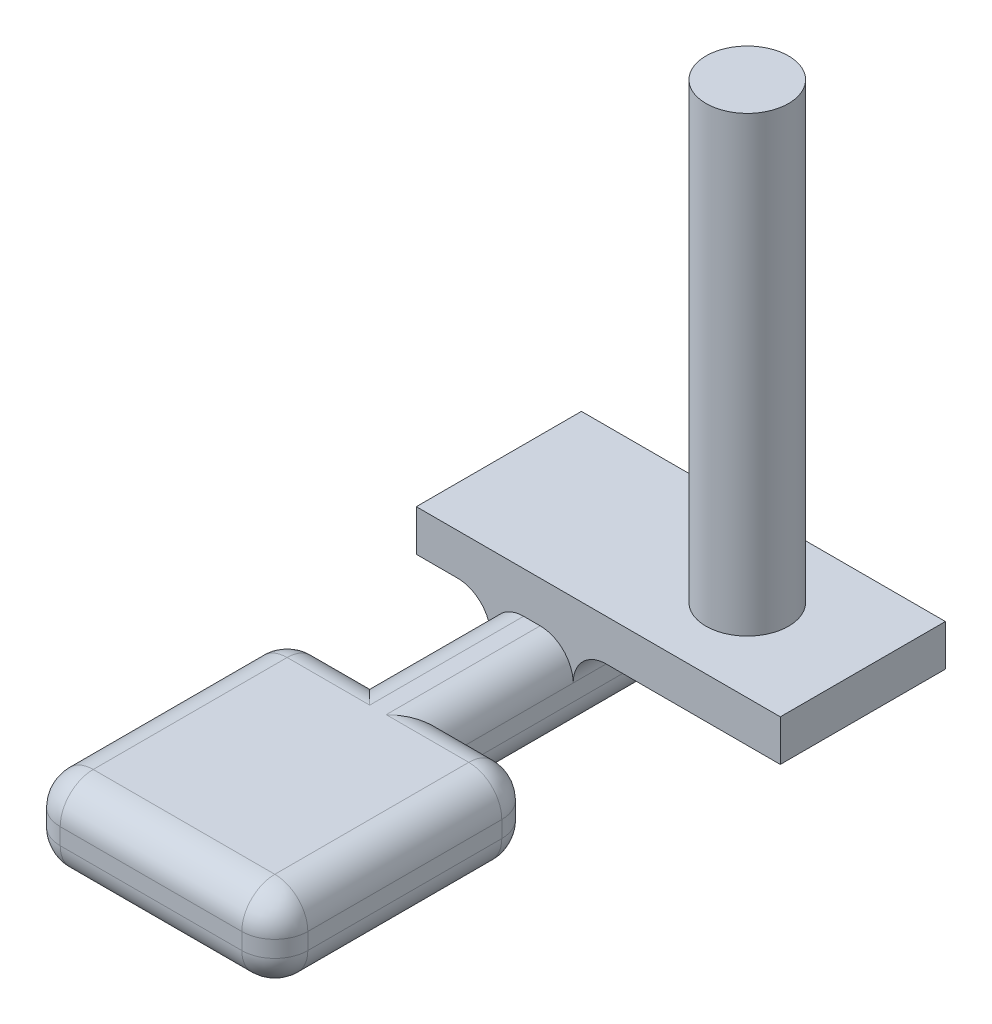
from build123d import *

# Parameters (mm, degrees)
SKETCH1_R           = 3.175
BOSS_EXTRUDE1_DEPTH = 19
SKETCH2_W           = 28
SKETCH2_H           = 12.7
BOSS_EXTRUDE2_DEPTH = 3.175
BOSS_EXTRUDE3_DEPTH = 6.35
FILLET1_R           = 2.54
FILLET2_R           = 2.54


with BuildPart() as part:
    # Sketch1 → Boss-Extrude1 (new, symmetric)
    with BuildSketch(Plane(origin=(0, 0, 0), x_dir=(1, 0, 0), z_dir=(0, 1, 0))):
        with Locations(Location((0, 0, 0), (0, 0, 270))):
            Circle(SKETCH1_R)
    extrude(amount=BOSS_EXTRUDE1_DEPTH, both=True)

    # Sketch2 → Boss-Extrude2 (add)
    with BuildSketch(Plane.XZ.offset(19)):
        with Locations((-5.11, 0)):
            Rectangle(SKETCH2_W, SKETCH2_H)
    extrude(amount=-BOSS_EXTRUDE2_DEPTH)

    # Sketch3 → Boss-Extrude3 (add)
    with BuildSketch(Plane.XZ.offset(19)):
        Polygon((-13.395, -6.35), (-13.395, 15.65), (-19.745, 15.65), (-19.745, 35.65), (-0.695, 35.65), (-0.695, 15.65), (-7.045, 15.65), (-7.045, -6.35), align=None)
    extrude(amount=BOSS_EXTRUDE3_DEPTH)

    # Fillet1
    fillet1_edges = [part.edges().sort_by_distance(p)[0] for p in [
        (-13.395, -25.35, 4.65),
        (-16.57, -25.35, 15.65),
        (-3.87, -25.35, 15.65),
        (-7.045, -25.35, 4.65),
        (-10.22, -25.35, -6.35),
        (-0.695, -22.175, 15.65),
        (-0.695, -25.35, 25.65),
        (-0.695, -19, 25.65),
        (-0.695, -22.175, 35.65),
        (-10.22, -25.35, 35.65),
        (-10.22, -19, 35.65),
        (-19.745, -22.175, 35.65),
        (-19.745, -25.35, 25.65),
        (-19.745, -22.175, 15.65),
        (-19.745, -19, 25.65),
        (-3.87, -19, 15.65),
        (-16.57, -19, 15.65),
        (-7.045, -19, 11),
        (-13.395, -19, 11),
        (-7.045, -22.175, -6.35),
        (-13.395, -22.175, -6.35),
    ]]
    fillet(fillet1_edges, radius=FILLET1_R)

    # Fillet2
    # the kernel refuses this fillet: 2.54 mm, written as the material it adds along each edge
    with BuildSketch(Plane(origin=(-9.585, -19, -3.81), x_dir=(-0.5976672776328281, 0, 0.8017442392976477), z_dir=(0.8017442392976477, 0, 0.5976672776328281))) as fillet2_piece_1_section:
        with BuildLine():
            CenterArc((2.54 + FILLET2_R, FILLET2_R), FILLET2_R, 180, 90)
            Line((2.54, FILLET2_R), (2.54, 0))
            Line((2.54, 0), (2.54 + FILLET2_R, 0))
        make_face()
    fillet2_piece_1 = revolve(axis=Axis((-9.585, -19, -3.81), (0, -1, 0)), revolution_arc=233.296989237, mode=Mode.PRIVATE)
    fillet2_piece_1 = split(fillet2_piece_1, bisect_by=Plane(origin=(-13.679769983, -19.079873008, -6.35), z_dir=(0, 0, 1)), keep=Keep.TOP, mode=Mode.PRIVATE)
    add(fillet2_piece_1)
    with BuildSketch(Plane(origin=(-10.855, -19, -3.81), x_dir=(0.5976672776328281, 0, 0.8017442392976477), z_dir=(-0.8017442392976477, 0, 0.5976672776328281))) as fillet2_piece_2_section:
        with BuildLine():
            CenterArc((2.54 + FILLET2_R, -FILLET2_R), FILLET2_R, 90, 90)
            Line((2.54, -FILLET2_R), (2.54, 0))
            Line((2.54, 0), (2.54 + FILLET2_R, 0))
        make_face()
    fillet2_piece_2 = revolve(axis=Axis((-10.855, -19, -3.81), (0, 1, 0)), revolution_arc=233.296989237, mode=Mode.PRIVATE)
    fillet2_piece_2 = split(fillet2_piece_2, bisect_by=Plane(origin=(-6.760230017, -19.079873008, -6.35), z_dir=(0, 0, 1)), keep=Keep.TOP, mode=Mode.PRIVATE)
    add(fillet2_piece_2)
    with BuildSketch(Plane(origin=(-7.045, -19, 6.35), x_dir=(1, 0, 0), z_dir=(0, 0, -1)), Plane(origin=(-13.395, -19, -3.81), x_dir=(-1, 0, 0), z_dir=(0, 0, 1))) as fillet2_piece_3:
        with BuildLine():
            CenterArc((FILLET2_R, FILLET2_R), FILLET2_R, 180, 90)
            Line((0, FILLET2_R), (0, 0))
            Line((0, 0), (FILLET2_R, 0))
        make_face()
    extrude(amount=10.16)


solid = part.part
